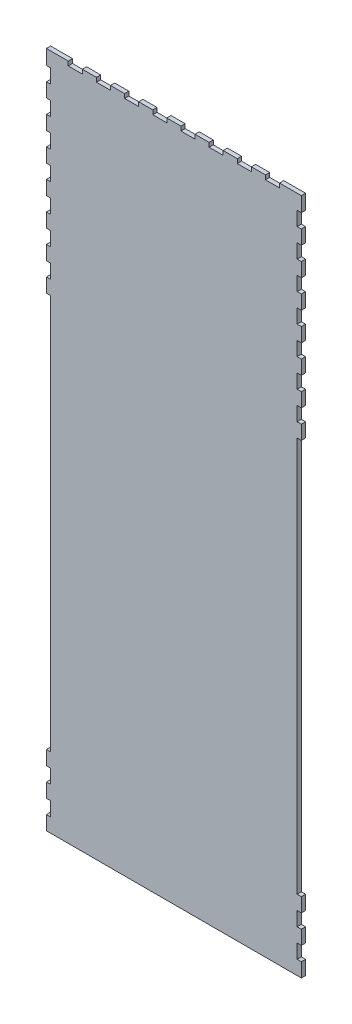
from build123d import *

# Parameters (mm, degrees)
BOSS_EXTRUDE1_DEPTH = 3


with BuildPart() as part:
    # Sketch1 → Boss-Extrude1 (new body)
    with BuildSketch(Plane.XY):
        Polygon((3, 408), (-12.5, 408), (-12.5, 405), (-22.5, 405), (-22.5, 408), (-32.5, 408), (-32.5, 405), (-42.5, 405), (-42.5, 408), (-52.5, 408), (-52.5, 405), (-62.5, 405), (-62.5, 408), (-72.5, 408), (-72.5, 405), (-82.5, 405), (-82.5, 408), (-92.5, 408), (-92.5, 405), (-102.5, 405), (-102.5, 408), (-112.5, 408), (-112.5, 405), (-122.5, 405), (-122.5, 408), (-132.5, 408), (-132.5, 405), (-142.5, 405), (-142.5, 408), (-152.5, 408), (-152.5, 405), (-162.5, 405), (-162.5, 408), (-178, 408), (-178, 397.5), (-175, 397.5), (-175, 387.5), (-178, 387.5), (-178, 377.5), (-175, 377.5), (-175, 367.5), (-178, 367.5), (-178, 357.5), (-175, 357.5), (-175, 347.5), (-178, 347.5), (-178, 337.5), (-175, 337.5), (-175, 327.5), (-178, 327.5), (-178, 317.5), (-175, 317.5), (-175, 307.5), (-178, 307.5), (-178, 297.5), (-175, 297.5), (-175, 287.5), (-178, 287.5), (-178, 277.5), (-175, 277.5), (-175, 267.5), (-178, 267.5), (-178, 257.5), (-175, 257.5), (-175, 0), (-175, -23), (-178, -23), (-178, -33), (-175, -33), (-175, -43), (-178, -43), (-178, -53), (-175, -53), (-175, -63), (-178, -63), (-178, -73), (3, -73), (3, -63), (0, -63), (0, -53), (3, -53), (3, -43), (0, -43), (0, -33), (3, -33), (3, -23), (0, -23), (0, 0), (0, 257.5), (3, 257.5), (3, 267.5), (0, 267.5), (0, 277.5), (3, 277.5), (3, 287.5), (0, 287.5), (0, 297.5), (3, 297.5), (3, 307.5), (0, 307.5), (0, 317.5), (3, 317.5), (3, 327.5), (0, 327.5), (0, 337.5), (3, 337.5), (3, 347.5), (0, 347.5), (0, 357.5), (3, 357.5), (3, 367.5), (0, 367.5), (0, 377.5), (3, 377.5), (3, 387.5), (0, 387.5), (0, 397.5), (3, 397.5), align=None)
    extrude(amount=BOSS_EXTRUDE1_DEPTH)


solid = part.part
